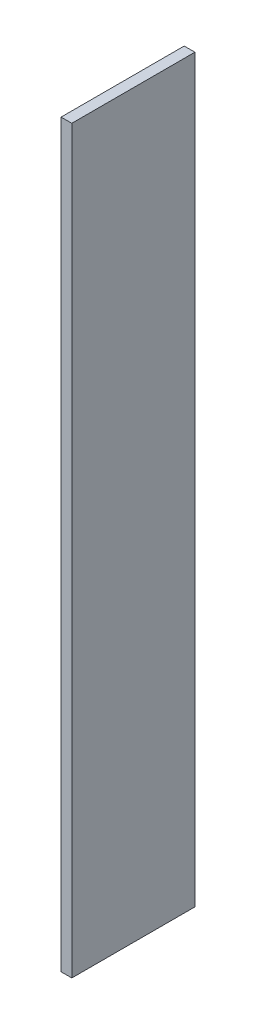
from build123d import *

# Parameters (mm, degrees)
SKETCH1_W           = 101.6
SKETCH1_H           = 1168.4
BOSS_EXTRUDE1_DEPTH = 7023.1


with BuildPart() as part:
    # Sketch1 → Boss-Extrude1 (new body)
    with BuildSketch(Plane(origin=(0, 0, 0), x_dir=(1, 0, 0), z_dir=(0, 1, 0))):
        Rectangle(SKETCH1_W, SKETCH1_H)
    extrude(amount=BOSS_EXTRUDE1_DEPTH)


solid = part.part
